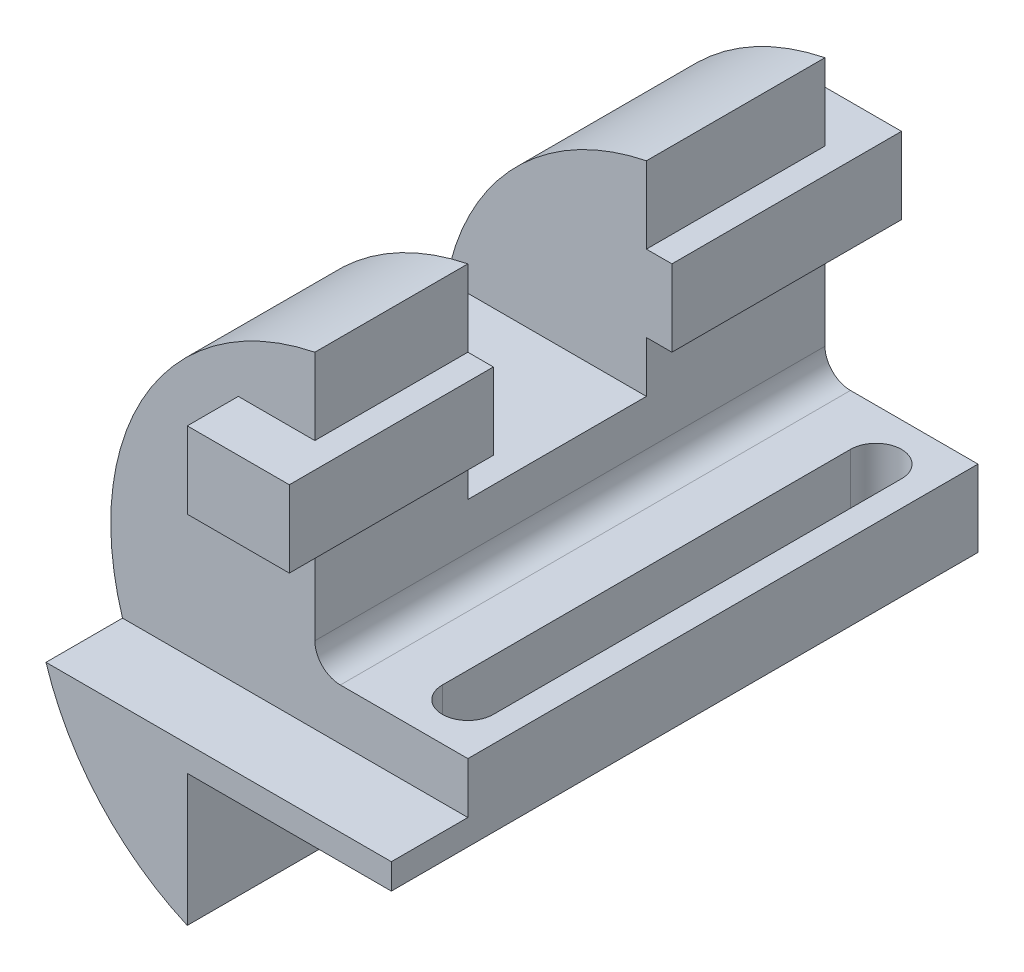
from build123d import *

# Parameters (mm, degrees)
BOSS_EXTRUDE1_DEPTH      = 115
CUT_EXTRUDE4_DEPTH       = 115
CUT_EXTRUDE5_DEPTH       = 115
CUT_EXTRUDE7_DEPTH       = 15
SKETCH8_W                = 35
SKETCH8_H                = 40
CUT_EXTRUDE8_DEPTH       = 55
BOSS_EXTRUDE2_DEPTH      = 10
BOSS_EXTRUDE2_DEPTH_BACK = 30
SKETCH9_W                = 20
SKETCH9_H                = 15
BOSS_EXTRUDE4_DEPTH      = 10
BOSS_EXTRUDE4_DEPTH_BACK = 35
SKETCH10_W               = 20
SKETCH10_H               = 15
CUT_EXTRUDE9_DEPTH       = 35


with BuildPart() as part:
    # Sketch1 → Boss-Extrude1 (new body)
    with BuildSketch(Plane.XY):
        with BuildLine():
            Line((0, 50), (0, -5))
            Line((0, -5), (20, -5))
            Line((20, -5), (20, -20))
            Line((20, -20), (0, -20))
            Line((0, -20), (0, -50))
            ThreePointArc((0, -50), (-50, 0), (0, 50))
        make_face()
    extrude(amount=-BOSS_EXTRUDE1_DEPTH)

    # Sketch2 → Cut-Extrude4 (cut)
    with BuildSketch(Plane.XY):
        with BuildLine():
            Line((0, -5), (-5, -5))
            ThreePointArc((-5, -5), (-8.535533906, -3.535533906), (-10, 0))
            Line((-10, 0), (-10, 48.989794856))
            ThreePointArc((-10, 48.989794856), (-5.0254481, 49.74680765), (0, 50))
            Line((0, 50), (0, -5))
        make_face()
    extrude(amount=-CUT_EXTRUDE4_DEPTH, mode=Mode.SUBTRACT)

    # Sketch6 → Cut-Extrude5 (cut)
    with BuildSketch(Plane.XY):
        with BuildLine():
            Line((0, -20), (-20, -20))
            Line((-20, -20), (-20, -45.82575695))
            ThreePointArc((-20, -45.82575695), (-10.215482184, -48.945315647), (0, -50))
            Line((0, -50), (0, -20))
        make_face()
    extrude(amount=-CUT_EXTRUDE5_DEPTH, mode=Mode.SUBTRACT)

    # Sketch7 → Cut-Extrude7 (cut)
    with BuildSketch(Plane.XY):
        with BuildLine():
            Line((20, -5), (-5, -5))
            ThreePointArc((-5, -5), (-8.535533906, -3.535533906), (-10, 0))
            Line((-10, 0), (-10, 48.989794856))
            ThreePointArc((-10, 48.989794856), (-43.080253734, 25.378962513), (-47.696960071, -15))
            Line((-47.696960071, -15), (20, -15))
            Line((20, -15), (20, -5))
        make_face()
    extrude(amount=-CUT_EXTRUDE7_DEPTH, mode=Mode.SUBTRACT)

    # Sketch8 → Cut-Extrude8 (cut)
    with BuildSketch(Plane(origin=(-10, 0, 0), x_dir=(0, 0, -1), z_dir=(1, 0, 0))):
        with Locations((62.5, 28.989794856)):
            Rectangle(SKETCH8_W, SKETCH8_H)
    extrude(amount=-CUT_EXTRUDE8_DEPTH, mode=Mode.SUBTRACT)

    # Sketch9 → Boss-Extrude2 (add, two sides: drawn at the far end of the back side and taken through both)
    with BuildSketch(Plane.XY.offset(-15).offset(-BOSS_EXTRUDE2_DEPTH_BACK)):
        with Locations((-15, 26.489794856)):
            Rectangle(SKETCH9_W, SKETCH9_H)
    extrude(amount=BOSS_EXTRUDE2_DEPTH + BOSS_EXTRUDE2_DEPTH_BACK)

    # Sketch10 → Boss-Extrude4 (add, two sides: drawn at the far end of the back side and taken through both)
    with BuildSketch(Plane(origin=(0, 0, -115), x_dir=(-1, 0, 0), z_dir=(0, 0, -1)).offset(-BOSS_EXTRUDE4_DEPTH_BACK)):
        with Locations((15, 26.489794856)):
            Rectangle(SKETCH10_W, SKETCH10_H)
    extrude(amount=BOSS_EXTRUDE4_DEPTH + BOSS_EXTRUDE4_DEPTH_BACK)

    # Sketch11 → Cut-Extrude9 (cut)
    with BuildSketch(Plane(origin=(0, -5, 0), x_dir=(1, 0, 0), z_dir=(0, 1, 0))):
        with BuildLine():
            Line((5, 105), (5, 25))
            ThreePointArc((5, 25), (10, 20), (15, 25))
            Line((15, 25), (15, 105))
            ThreePointArc((15, 105), (10, 110), (5, 105))
        make_face()
    extrude(amount=-CUT_EXTRUDE9_DEPTH, mode=Mode.SUBTRACT)


solid = part.part
